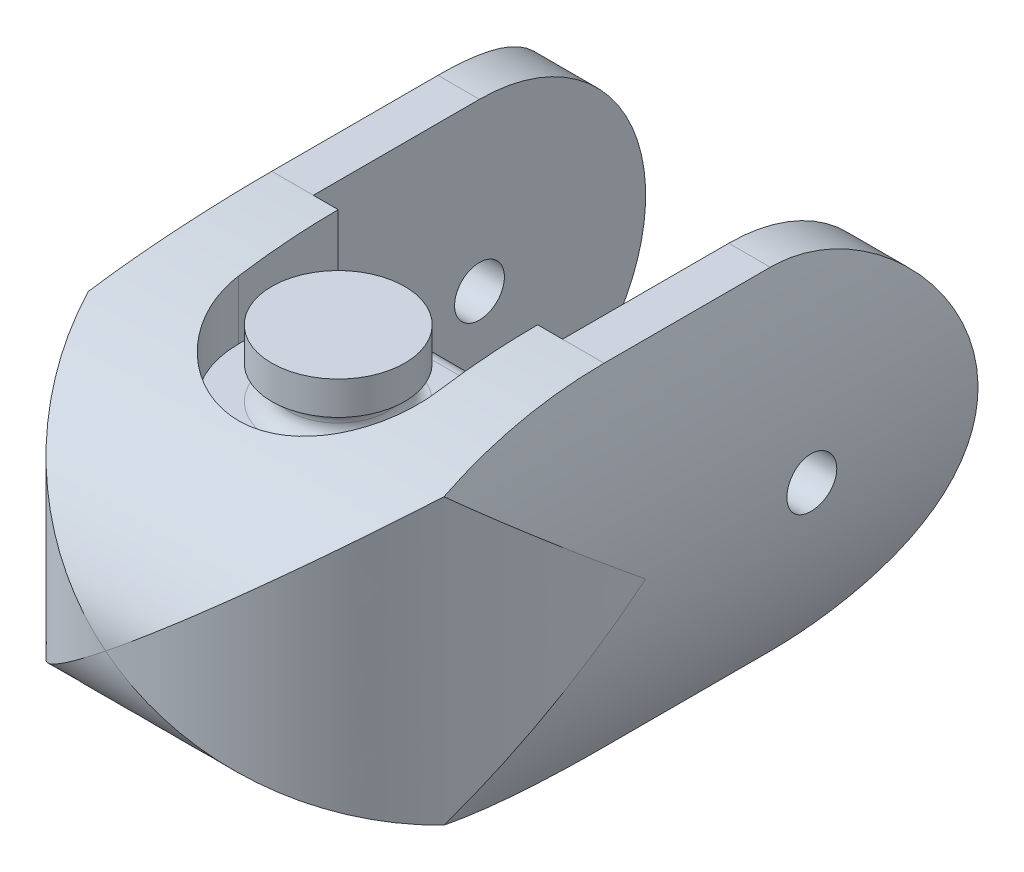
from build123d import *

# Parameters (mm, degrees)
SALIENTE_EXTRUIR1_DEPTH    = 40
CROQUIS3_R                 = 1.5
CORTAR_EXTRUIR2_DEPTH      = 40
CROQUIS2_W                 = 15
CROQUIS2_H                 = 20
CORTAR_EXTRUIR1_DEPTH      = 20
CORTAR_EXTRUIR3_DEPTH      = 44.084219849
CORTAR_EXTRUIR3_DEPTH_BACK = 44.084219849
CROQUIS4_R                 = 1.5
CORTAR_EXTRUIR4_DEPTH      = 44.08422
CORTAR_EXTRUIR4_DEPTH_BACK = 44.08422
CORTAR_EXTRUIR5_DEPTH      = 44.084220001
CORTAR_EXTRUIR5_DEPTH_BACK = 44.084220001
CUT_EXTRUDE1_DEPTH         = 4
SKETCH2_R                  = 3
BOSS_EXTRUDE1_DEPTH        = 2
SKETCH3_R                  = 4
BOSS_EXTRUDE2_DEPTH        = 2
FILLET1_R                  = 1
FILLET2_R                  = 1
FILLET3_R                  = 1


with BuildPart() as part:
    # Croquis1 → Saliente-Extruir1 (new body)
    with BuildSketch(Plane.XY):
        with BuildLine():
            Line((-10, 10), (10, 10))
            ThreePointArc((10, 10), (12.5, 0), (10, -10))
            Line((10, -10), (-10, -10))
            ThreePointArc((-10, -10), (-12.5, 0), (-10, 10))
        make_face()
    extrude(amount=SALIENTE_EXTRUIR1_DEPTH)

    # Croquis3 → Cortar-Extruir2 (cut)
    with BuildSketch(Plane(origin=(0, 0, 0), x_dir=(-1, 0, 0), z_dir=(0, 0, -1))):
        with Locations((0, -7)):
            Circle(CROQUIS3_R)
    extrude(amount=-CORTAR_EXTRUIR2_DEPTH, mode=Mode.SUBTRACT)

    # Croquis2 → Cortar-Extruir1 (cut)
    with BuildSketch(Plane(origin=(0, 0, 0), x_dir=(-1, 0, 0), z_dir=(0, 0, -1))):
        Rectangle(CROQUIS2_W, CROQUIS2_H)
    extrude(amount=-CORTAR_EXTRUIR1_DEPTH, mode=Mode.SUBTRACT)

    # Croquis4 → Cortar-Extruir3 (cut, two sides: drawn at the far end of the back side and taken through both)
    with BuildSketch(Plane(origin=(0, 0, 0), x_dir=(0, 0, -1), z_dir=(1, 0, 0)).offset(-CORTAR_EXTRUIR3_DEPTH_BACK)):
        with Locations((-10, 0)):
            Circle(CROQUIS4_R)
        with BuildLine():
            Line((-10, -10), (3, -10))
            Line((3, -10), (3, 10))
            Line((3, 10), (-10, 10))
            ThreePointArc((-10, 10), (0, 0), (-10, -10))
        make_face()
    extrude(amount=CORTAR_EXTRUIR3_DEPTH + CORTAR_EXTRUIR3_DEPTH_BACK, mode=Mode.SUBTRACT)

    # Croquis5 → Cortar-Extruir4 (cut, two sides: drawn at the far end of the back side and taken through both)
    with BuildSketch(Plane(origin=(0, 0, 0), x_dir=(1, 0, 0), z_dir=(0, 1, 0)).offset(-CORTAR_EXTRUIR4_DEPTH_BACK)):
        with BuildLine():
            Line((-12.5, -20), (-12.5, -42))
            Line((-12.5, -42), (12.5, -42))
            Line((12.5, -42), (12.5, -20))
            add(Edge.make_bspline(
                [(-12.5, -20), (-12.5, -40), (0, -40), (12.5, -40), (12.5, -20)],
                knots=[4.71238898, 4.71238898, 4.71238898, 6.283185307, 6.283185307, 7.853981634, 7.853981634, 7.853981634], degree=2, weights=[1, 0.707106781, 1, 0.707106781, 1]))
        make_face()
    extrude(amount=CORTAR_EXTRUIR4_DEPTH + CORTAR_EXTRUIR4_DEPTH_BACK, mode=Mode.SUBTRACT)

    # Croquis6 → Cortar-Extruir5 (cut, two sides: drawn at the far end of the back side and taken through both)
    with BuildSketch(Plane(origin=(0, 0, 0), x_dir=(0, 0, -1), z_dir=(1, 0, 0)).offset(-CORTAR_EXTRUIR5_DEPTH_BACK)):
        with BuildLine():
            Line((-20, 10), (-42, 10))
            Line((-42, 10), (-42, -10))
            Line((-42, -10), (-20, -10))
            add(Edge.make_bspline(
                [(-20, 10), (-40, 10), (-40, 0), (-40, -10), (-20, -10)],
                knots=[4.71238898, 4.71238898, 4.71238898, 6.283185307, 6.283185307, 7.853981634, 7.853981634, 7.853981634], degree=2, weights=[1, 0.707106781, 1, 0.707106781, 1]))
        make_face()
    extrude(amount=CORTAR_EXTRUIR5_DEPTH + CORTAR_EXTRUIR5_DEPTH_BACK, mode=Mode.SUBTRACT)

    # Sketch1 → Cut-Extrude1 (cut)
    with BuildSketch(Plane(origin=(0, 10, 0), x_dir=(1, 0, 0), z_dir=(0, 1, 0))):
        with BuildLine():
            Line((-6, -26), (-6, -20))
            Line((-6, -20), (6, -20))
            Line((6, -20), (6, -26))
            ThreePointArc((6, -26), (0, -32), (-6, -26))
        make_face()
    extrude(amount=-CUT_EXTRUDE1_DEPTH, mode=Mode.SUBTRACT)

    # Sketch2 → Boss-Extrude1 (add)
    with BuildSketch(Plane(origin=(0, 6, 0), x_dir=(1, 0, 0), z_dir=(0, 1, 0))):
        with Locations(Location((0, -26, 0), (0, 0, 270))):
            Circle(SKETCH2_R)
    extrude(amount=BOSS_EXTRUDE1_DEPTH)

    # Sketch3 → Boss-Extrude2 (add)
    with BuildSketch(Plane(origin=(0, 8, 0), x_dir=(1, 0, 0), z_dir=(0, 1, 0))):
        with Locations(Location((0, -26, 0), (0, 0, 270))):
            Circle(SKETCH3_R)
    extrude(amount=BOSS_EXTRUDE2_DEPTH)

    # Fillet1
    fillet1_edges = [part.edges().sort_by_distance(p)[0] for p in [
        (0, 6, 23),
        (0, 8, 23),
    ]]
    fillet(fillet1_edges, radius=FILLET1_R - 0.0001)  # a hair under: the kernel refuses the full size

    # Fillet2
    fillet2_edges = [part.edges().sort_by_distance(p)[0] for p in [
        (0, 6, 20),
    ]]
    fillet(fillet2_edges, radius=FILLET2_R)

    # Fillet3
    fillet3_edges = [part.edges().sort_by_distance(p)[0] for p in [
        (1.5, -7, 20),
    ]]
    fillet(fillet3_edges, radius=FILLET3_R)


solid = part.part
